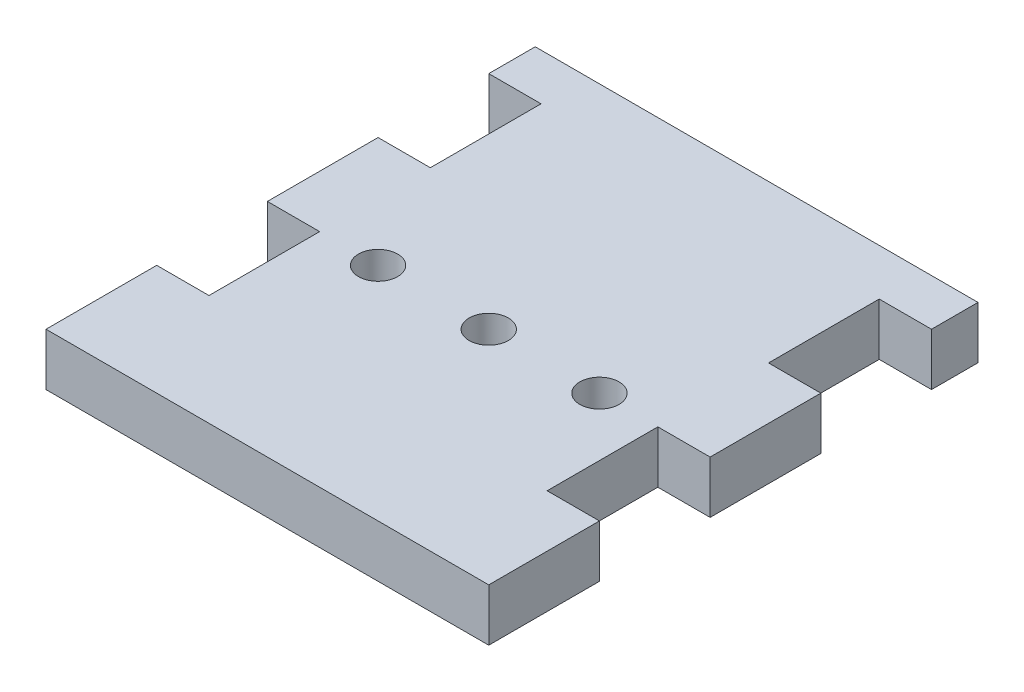
from build123d import *

# Parameters (mm, degrees)
SKETCH1_W            = 50.8
SKETCH1_H            = 56.134
MAIN_DEPTH           = 6
SKETCH2_W            = 6
SKETCH2_H            = 12.7
ACRYLIC_MOUNTS_DEPTH = 39.326446339
SKETCH3_R            = 2.2479
CUT_EXTRUDE1_DEPTH   = 39.326446339


with BuildPart() as part:
    # Sketch1 → Main (new body)
    with BuildSketch(Plane(origin=(0, 0, 0), x_dir=(1, 0, 0), z_dir=(0, 1, 0))):
        Rectangle(SKETCH1_W, SKETCH1_H)
    extrude(amount=MAIN_DEPTH)

    # Sketch2 → Acrylic Mounts (cut, through all)
    with BuildSketch(Plane(origin=(0, 6, 0), x_dir=(1, 0, 0), z_dir=(0, 1, 0))):
        with Locations((-22.4, -9.017)):
            Rectangle(SKETCH2_W, SKETCH2_H)
        with Locations((-22.4, 16.383)):
            Rectangle(SKETCH2_W, SKETCH2_H)
        with Locations((22.4, 16.383)):
            Rectangle(SKETCH2_W, SKETCH2_H)
        with Locations((22.4, -9.017)):
            Rectangle(SKETCH2_W, SKETCH2_H)
    extrude(amount=-ACRYLIC_MOUNTS_DEPTH, mode=Mode.SUBTRACT)

    # Sketch3 → Cut-Extrude1 (cut, through all)
    with BuildSketch(Plane(origin=(0, 0, 0), x_dir=(-1, 0, 0), z_dir=(0, -1, 0))):
        with Locations((12.7, -2.667)):
            Circle(SKETCH3_R)
        with Locations((-12.7, -2.667)):
            Circle(SKETCH3_R)
        with Locations((0, -2.667)):
            Circle(SKETCH3_R)
    extrude(amount=-CUT_EXTRUDE1_DEPTH, mode=Mode.SUBTRACT)


solid = part.part
